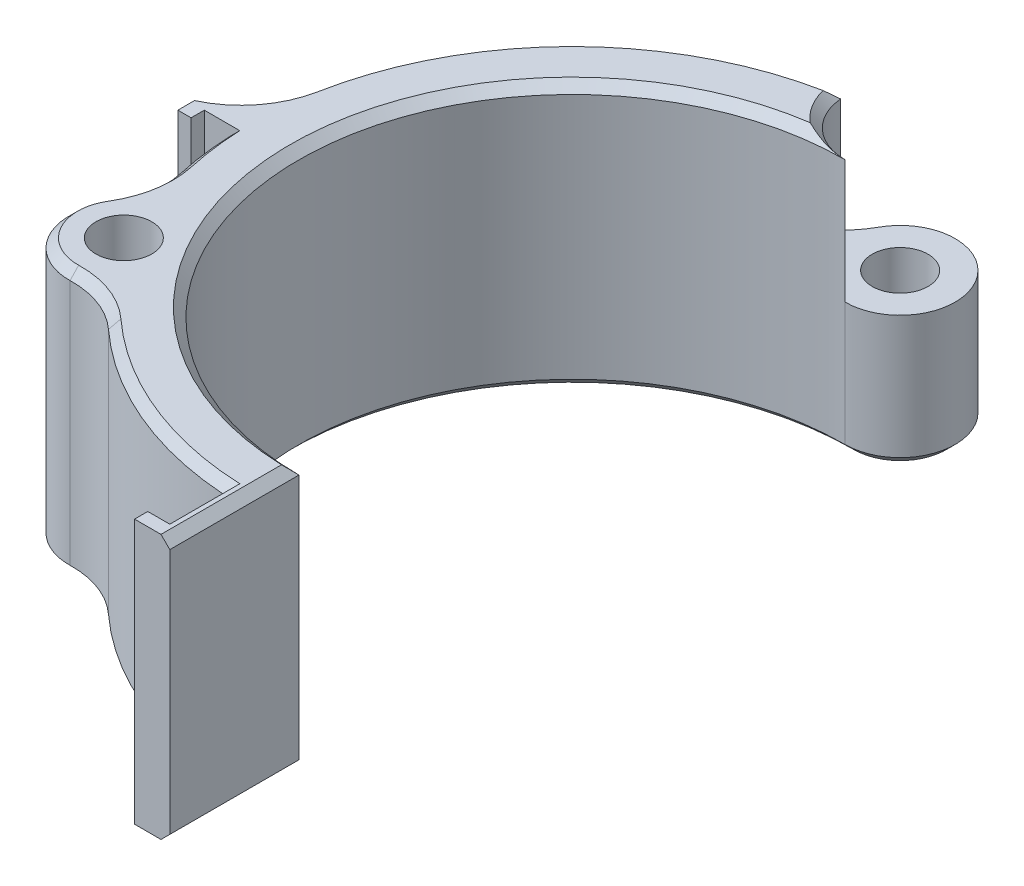
from build123d import *

# Parameters (mm, degrees)
SKETCH3_R           = 3.174999999999997
BOSS_EXTRUDE2_DEPTH = 30
SKETCH3_6_R         = 6.249999999999999
SKETCH3_6_R_2       = 3.174999999999996
BOSS_EXTRUDE3_DEPTH = 15
FILLET1_R           = 10
CHAMFER1_SIZE       = 1


with BuildPart() as part:
    # Sketch3 → Boss-Extrude2 (new body)
    with BuildSketch(Plane(origin=(0, 0, 0), x_dir=(1, 0, 0), z_dir=(0, 1, 0))):
        with BuildLine():
            ThreePointArc((-9.29e-15, 31), (-4.229978997044333, 32.64893733094583), (-6.227967505338837, 36.72567114093955))
            ThreePointArc((-6.227967505338856, 36.72567114093959), (-28.456583505173906, 24.03716612275798), (-37.249999999999986, -3.82e-15))
            Line((-37.25, 0), (-41.75, -5.5e-16))
            Line((-41.75, -5.5e-16), (-41.75, -3.000000000000001))
            Line((-41.75, -3.000000000000001), (-40.25, -3.000000000000001))
            Line((-40.25, -3.000000000000001), (-40.25, -1.5000000000000004))
            Line((-40.25, -1.5000000000000004), (-37.21978640454563, -1.5000000000000004))
            ThreePointArc((-37.21978640454562, -1.5000000000000002), (-36.52259085251633, -7.325493663889764), (-34.919347931756114, -12.969257496902395))
            ThreePointArc((-34.91934793175618, -12.969257496902411), (-37.67210506462307, -21.75000000000005), (-28.691380426417297, -23.75641364403726))
            ThreePointArc((-28.691380426417272, -23.756413644037238), (-16.975861979154317, -33.15693909372066), (-2.5, -37.166012699777184))
            Line((-2.4999999999999982, -37.1660126997772), (-2.4999999999999982, -44.1660126997772))
            Line((-2.4999999999999982, -44.1660126997772), (-3.9999999999999982, -44.1660126997772))
            Line((-3.9999999999999982, -44.1660126997772), (-3.9999999999999982, -45.6660126997772))
            Line((-3.9999999999999982, -45.6660126997772), (1.8e-15, -45.6660126997772))
            Line((1.8e-15, -45.6660126997772), (8.2e-16, -30.99999999999999))
            ThreePointArc((8.2e-16, -30.999999999999986), (-30.999999999999986, -3.39e-15), (-1.128e-14, 30.999999999999993))
        make_face()
        with Locations(Location((-32.25944629097033, -18.62500000000002, 0), (0, 0, 270))):
            Circle(SKETCH3_R, mode=Mode.SUBTRACT)
    extrude(amount=BOSS_EXTRUDE2_DEPTH)

    # Sketch3<6> → Boss-Extrude3 (add)
    with BuildSketch(Plane(origin=(0, 0, 0), x_dir=(1, 0, 0), z_dir=(0, 1, 0))):
        with Locations((-8.14e-15, 37.25)):
            Circle(SKETCH3_6_R)
        with Locations(Location((-8.14e-15, 37.25, 0), (0, 0, 270))):
            Circle(SKETCH3_6_R_2, mode=Mode.SUBTRACT)
    extrude(amount=BOSS_EXTRUDE3_DEPTH)

    # Fillet1
    # the kernel refuses this fillet: 10 mm, written as the material it adds along each edge
    with BuildSketch(Plane(origin=(-28.691380426417282, 0, 23.75641364403725), x_dir=(-0.9506898736636257, 0, 0.3101431348803961), z_dir=(0, 1, 0))) as fillet1_piece_1:
        with BuildLine():
            CenterArc((6.482344939436471, 9.575990594652419), FILLET1_R, 209.4937649075162, 43.761742692679945)
            ThreePointArc((-2.221747837989829, 4.652702169021102), (-1.030276989978153, 2.3648375481367587), (0, 0))
            ThreePointArc((0, 0), (1.8006513720656931, 0.26500587834223527), (3.6013027441313774, -6e-17))
        make_face()
    extrude(amount=30)
    with BuildSketch(Plane(origin=(-34.91934793175615, 0, 12.969257496902403), x_dir=(-0.7439367704475782, 0, 0.6682500142731217), z_dir=(0, 1, 0))) as fillet1_piece_2:
        with BuildLine():
            CenterArc((6.482344939436458, -9.575990594652419), FILLET1_R, 106.74449239980393, 43.76174269267989)
            ThreePointArc((-2.2217478379898448, -4.652702169021106), (-1.0302769899781694, -2.364837548136756), (0, 0))
            ThreePointArc((0, 0), (1.8006513720656803, -0.26500587834223843), (3.601302744131356, 6e-17))
        make_face()
    extrude(amount=30)
    with BuildSketch(Plane(origin=(-6.227967505338847, 0, -36.725671140939575), x_dir=(-0.9719890656078827, 0, 0.23502607586971094), z_dir=(0, 1, 0))) as fillet1_piece_3:
        with BuildLine():
            CenterArc((5.848021683595468, -9.976022963631705), FILLET1_R, 93.96846171792617, 43.7617426926798)
            ThreePointArc((-1.5518361342237537, -3.2497978502371354), (-0.5367780683599742, -1.7390925175521244), (0, 0))
            ThreePointArc((0, 0), (2.5779740557861452, -0.08931446047189494), (5.1559481115722905, 1e-17))
        make_face()
    extrude(amount=15)
    with BuildSketch(Plane(origin=(-37.24999999999999, 0, 1.78e-15), x_dir=(-1, 0, -7.737e-14), z_dir=(0, 1, 0))) as fillet1_piece_4:
        with BuildLine():
            CenterArc((9.164670658683216, -8.845385669716253), FILLET1_R, 117.80520941997419, 51.405137085838774)
            ThreePointArc((-0.6585400627312272, -6.973346374538821), (-0.16500045393500687, -3.5021862698004864), (0, 0))
            Line((0, 0), (4.500000000000192, 0))
        make_face()
    extrude(amount=30)

    # Chamfer1
    chamfer1_edges = [part.edges().sort_by_distance(p)[0] for p in [
        (-7.903771868670522, 0, -37.32519260636591),
        (-38.375294648334496, 0, -2.898249101229199),
        (-38.375294648334496, 30, -2.898249101229199),
        (-36.27645093259372, 0, 11.817729079196308),
        (-36.27645093259372, 30, 11.817729079196308),
        (-30.999999999999986, 0, 5.16e-15),
        (1.31e-15, 0, 38.33300634988859),
        (-2.4999999999999982, 0, 40.6660126997772),
        (-14.640454765554196, 0, 34.25229312407797),
        (-14.640454765554196, 30, 34.25229312407797),
        (-2.4999999999999982, 30, 40.6660126997772),
        (1.31e-15, 30, 38.33300634988859),
        (-30.999999999999986, 30, 5.16e-15),
        (-4.2299789970443324, 30, -32.64893733094583),
        (5.376209478406283, 0, -40.43729848685283),
        (-37.672105064623324, 0, 21.749999999999595),
        (-37.672105064623324, 30, 21.749999999999595),
        (-27.849428165120642, 0, -24.7380648167108),
        (-26.07059740166155, 30, -26.60613559163521),
        (-36.941998560282954, 0, 4.780297310006034),
        (-36.941998560282954, 30, 4.780297310006034),
        (-28.372679063924544, 0, 25.507463527167676),
        (-28.372679063924544, 30, 25.507463527167676),
    ]]
    chamfer(chamfer1_edges, length=CHAMFER1_SIZE)


solid = part.part
